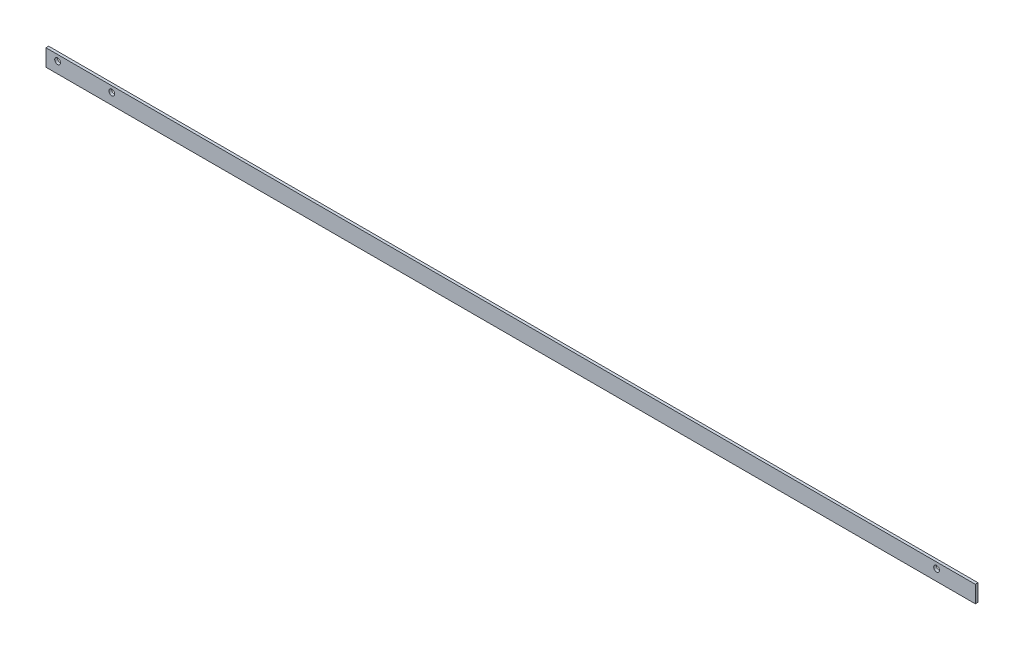
from build123d import *

# Parameters (mm, degrees)
SKETCH1_W             = 609.6
SKETCH1_H             = 11.0998
BOSS_EXTRUDE1_DEPTH   = 0.889
F_6_CLEARANCE_HOLE1_D = 3.7973


with BuildPart() as part:
    # Sketch1 → Boss-Extrude1 (new, symmetric)
    with BuildSketch(Plane.XY):
        Rectangle(SKETCH1_W, SKETCH1_H)
    extrude(amount=BOSS_EXTRUDE1_DEPTH, both=True)

    # #6 Clearance Hole1 (through all)
    with Locations(Plane.XY.offset(0.889)):
        with Locations((-297.18, 1.7399), (-261.62, 1.7399), (279.4, 1.7399)):
            Hole(F_6_CLEARANCE_HOLE1_D / 2)


solid = part.part
